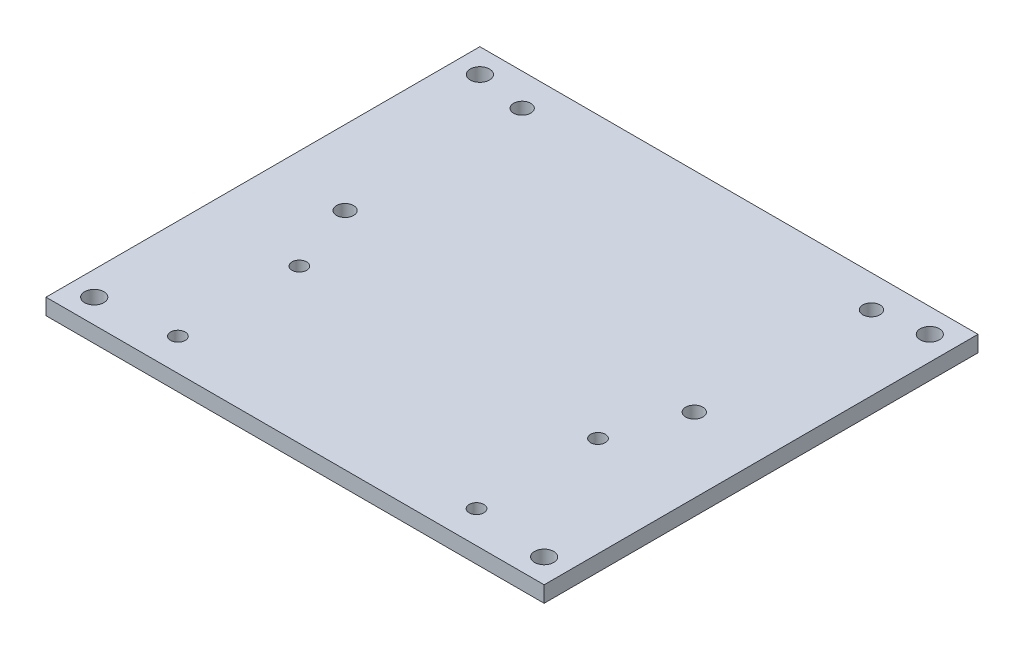
from build123d import *

# Parameters (mm, degrees)
SKETCH1_W              = 98.425
SKETCH1_H              = 85.725
BOSS_EXTRUDE1_DEPTH    = 3.175
F_6_CLEARANCE_HOLE1_D  = 3.7973
M2_5_CLEARANCE_HOLE1_D = 2.9
M3_CLEARANCE_HOLE1_D   = 3.4


with BuildPart() as part:
    # Sketch1 → Boss-Extrude1 (new body)
    with BuildSketch(Plane(origin=(0, 0, 0), x_dir=(1, 0, 0), z_dir=(0, 1, 0))):
        Rectangle(SKETCH1_W, SKETCH1_H)
    extrude(amount=BOSS_EXTRUDE1_DEPTH)

    # #6 Clearance Hole1 (through all)
    with Locations(Plane(origin=(-44.45, 0, 38.1), x_dir=(0, 0, -1), z_dir=(0, -1, 0))):
        with Locations((0, 0), (0, 88.9), (76.2, 0), (76.2, 88.9)):
            Hole(F_6_CLEARANCE_HOLE1_D / 2)

    # M2.5 Clearance Hole1 (through all)
    with Locations(Plane(origin=(-29.5, 3.175, 36.5125), x_dir=(0, 0, 1), z_dir=(0, 1, 0))):
        with Locations((0, 0), (-24, 0), (-24, 59), (0, 59)):
            Hole(M2_5_CLEARANCE_HOLE1_D / 2)

    # M3 Clearance Hole1 (through all)
    with Locations(Plane(origin=(-34.5, 3.175, -36.5125), x_dir=(0, 0, 1), z_dir=(0, 1, 0))):
        with Locations((0, 0), (0, 69), (35, 69), (35, 0)):
            Hole(M3_CLEARANCE_HOLE1_D / 2)


solid = part.part
